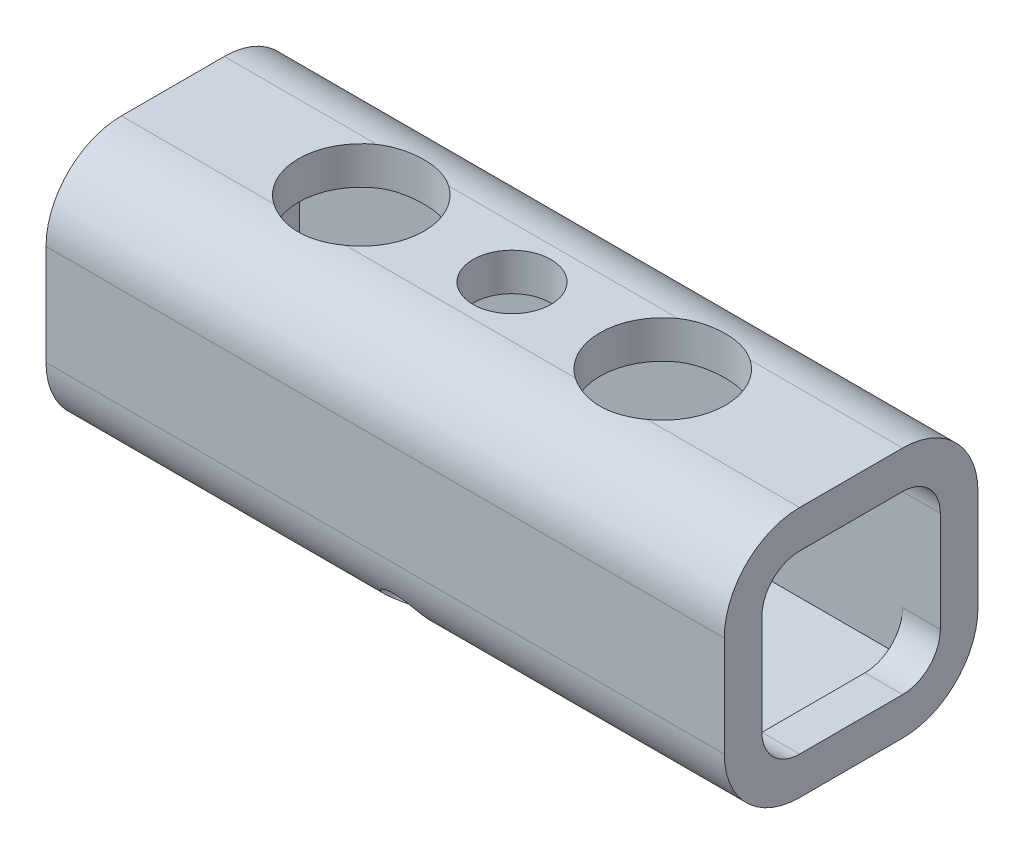
from build123d import *

# Parameters (mm, degrees)
SKETCH1_W               = 27
SKETCH1_H               = 10.1
SKETCH1_W_2             = 24
SKETCH1_H_2             = 7.1
SKETCH1_R               = 2.5
SKETCH1_R_2             = 1.55
BOSS_EXTRUDE2_DEPTH     = 10
CUT_EXTRUDE2_START      = 10
SKETCH1_5_R             = 2.5
SKETCH1_5_R_2           = 1.55
CUT_EXTRUDE2_DEPTH      = 2.7
FILLET1_R               = 3
CUT_EXTRUDE3_START      = 7.8
SKETCH1_6_W             = 24
SKETCH1_6_H             = 7.1
SKETCH1_6_R             = 2.5
SKETCH1_6_R_2           = 1.55
CUT_EXTRUDE3_DEPTH      = 6.5
SKETCH2_R               = 1.475
CUT_EXTRUDE4_DEPTH      = 25
CUT_EXTRUDE5_DEPTH      = 30.23187487
CUT_EXTRUDE5_DEPTH_BACK = 30.23187487
SKETCH2_3_R             = 1.475
SKETCH3_R               = 0.9
CUT_EXTRUDE6_DEPTH      = 18.54287621


with BuildPart() as part:
    # Sketch1 → Boss-Extrude2 (new body)
    # profile 1 of 5: a face of its own
    with BuildSketch(Plane(origin=(0, 0, 0), x_dir=(1, 0, 0), z_dir=(0, 1, 0))):
        Rectangle(SKETCH1_W, SKETCH1_H)
        Rectangle(SKETCH1_W_2, SKETCH1_H_2, mode=Mode.SUBTRACT)
    # profile 2 of 5: a face of its own
    with BuildSketch(Plane(origin=(0, 0, 0), x_dir=(1, 0, 0), z_dir=(0, 1, 0))):
        Rectangle(SKETCH1_W_2, SKETCH1_H_2)
        with Locations((6, 0)):
            Circle(SKETCH1_R, mode=Mode.SUBTRACT)
        Circle(SKETCH1_R_2, mode=Mode.SUBTRACT)
        with Locations((-6, 0)):
            Circle(SKETCH1_R, mode=Mode.SUBTRACT)
    # profile 3 of 5: a face of its own
    with BuildSketch(Plane(origin=(0, 0, 0), x_dir=(1, 0, 0), z_dir=(0, 1, 0))):
        with Locations((-6, 0)):
            Circle(SKETCH1_R)
    # profile 4 of 5: a face of its own
    with BuildSketch(Plane(origin=(0, 0, 0), x_dir=(1, 0, 0), z_dir=(0, 1, 0))):
        Circle(SKETCH1_R_2)
    # profile 5 of 5: a face of its own
    with BuildSketch(Plane(origin=(0, 0, 0), x_dir=(1, 0, 0), z_dir=(0, 1, 0))):
        with Locations((6, 0)):
            Circle(SKETCH1_R)
    extrude(amount=BOSS_EXTRUDE2_DEPTH)

    # Sketch1<5> → Cut-Extrude2 (cut)
    with BuildSketch(Plane(origin=(0, 0, 0), x_dir=(1, 0, 0), z_dir=(0, 1, 0)).offset(CUT_EXTRUDE2_START)):
        with Locations(Location((6, 0, 0), (0, 0, 270))):
            Circle(SKETCH1_5_R)
        with Locations(Location((0, 0, 0), (0, 0, 270))):
            Circle(SKETCH1_5_R_2)
        with Locations(Location((-6, 0, 0), (0, 0, 270))):
            Circle(SKETCH1_5_R)
    extrude(amount=-CUT_EXTRUDE2_DEPTH, mode=Mode.SUBTRACT)

    # Fillet1
    # the kernel refuses this fillet: 3 mm, written as the material it takes off along each edge
    with BuildSketch(Plane(origin=(21, 10, 5.05), x_dir=(0, 0, -1), z_dir=(-1, 0, 0)), Plane(origin=(-21, 0, -5.05), x_dir=(0, 1, 0), z_dir=(1, 0, 0))) as fillet1_piece_1:
        with BuildLine():
            CenterArc((FILLET1_R, FILLET1_R), FILLET1_R, 180, 90)
            Line((0, FILLET1_R), (0, 0))
            Line((0, 0), (FILLET1_R, 0))
        make_face()
    extrude(amount=42, mode=Mode.SUBTRACT)
    with BuildSketch(Plane(origin=(-21, 10, -5.05), x_dir=(0, -1, 0), z_dir=(1, 0, 0)), Plane(origin=(21, 0, 5.05), x_dir=(0, 0, -1), z_dir=(-1, 0, 0))) as fillet1_piece_2:
        with BuildLine():
            CenterArc((FILLET1_R, -FILLET1_R), FILLET1_R, 90, 90)
            Line((0, -FILLET1_R), (0, 0))
            Line((0, 0), (FILLET1_R, 0))
        make_face()
    extrude(amount=42, mode=Mode.SUBTRACT)

    # Sketch1<6> → Cut-Extrude3 (cut)
    with BuildSketch(Plane(origin=(0, 0, 0), x_dir=(1, 0, 0), z_dir=(0, 1, 0)).offset(CUT_EXTRUDE3_START)):
        Rectangle(SKETCH1_6_W, SKETCH1_6_H)
        with Locations(Location((6, 0, 0), (0, 0, 270))):
            Circle(SKETCH1_6_R, mode=Mode.SUBTRACT)
        with Locations(Location((0, 0, 0), (0, 0, 270))):
            Circle(SKETCH1_6_R_2, mode=Mode.SUBTRACT)
        with Locations(Location((-6, 0, 0), (0, 0, 270))):
            Circle(SKETCH1_6_R, mode=Mode.SUBTRACT)
    extrude(amount=-CUT_EXTRUDE3_DEPTH, mode=Mode.SUBTRACT)

    # Sketch2 → Cut-Extrude4 (cut)
    # profile 1 of 2: a face of its own
    with BuildSketch(Plane(origin=(13.5, 0, 0), x_dir=(0, 0, -1), z_dir=(1, 0, 0))):
        with BuildLine():
            Line((2.05, 8.5), (-2.05, 8.5))
            ThreePointArc((-2.05, 8.5), (-3.110660172, 8.060660172), (-3.55, 7))
            Line((-3.55, 7), (-3.55, 3))
            ThreePointArc((-3.55, 3), (-3.110660172, 1.939339828), (-2.05, 1.5))
            Line((-2.05, 1.5), (2.05, 1.5))
            ThreePointArc((2.05, 1.5), (3.110660172, 1.939339828), (3.55, 3))
            Line((3.55, 3), (3.55, 7))
            ThreePointArc((3.55, 7), (3.110660172, 8.060660172), (2.05, 8.5))
        make_face()
        with Locations((0, 5)):
            Circle(SKETCH2_R, mode=Mode.SUBTRACT)
    # profile 2 of 2: a face of its own
    with BuildSketch(Plane(origin=(13.5, 0, 0), x_dir=(0, 0, -1), z_dir=(1, 0, 0))):
        with Locations((0, 5)):
            Circle(SKETCH2_R)
    extrude(amount=-CUT_EXTRUDE4_DEPTH, mode=Mode.SUBTRACT)

    # Sketch2<3> → Cut-Extrude5 (cut, two sides: drawn at the far end of the back side and taken through both)
    with BuildSketch(Plane(origin=(13.5, 0, 0), x_dir=(0, 0, -1), z_dir=(1, 0, 0)).offset(-CUT_EXTRUDE5_DEPTH_BACK)):
        with Locations((0, 5)):
            Circle(SKETCH2_3_R)
    extrude(amount=CUT_EXTRUDE5_DEPTH + CUT_EXTRUDE5_DEPTH_BACK, mode=Mode.SUBTRACT)

    # Sketch3 → Cut-Extrude6 (cut, through all)
    with BuildSketch(Plane(origin=(0, 0, 0), x_dir=(1, 0, 0), z_dir=(0, -0.7071067811865475, 0.7071067811865477))):
        with Locations(Location((0, 3.570889245, 0), (0, 0, 90))):
            Circle(SKETCH3_R)
    extrude(amount=CUT_EXTRUDE6_DEPTH, mode=Mode.SUBTRACT)


solid = part.part
